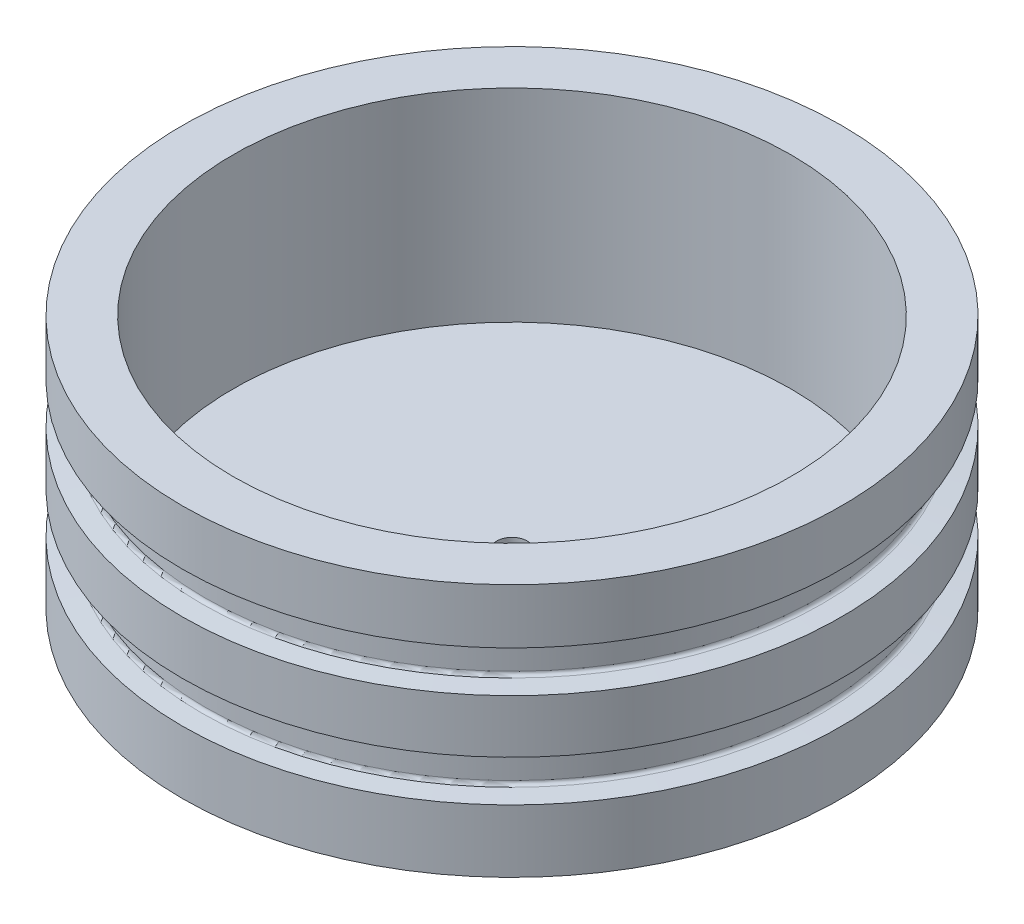
from build123d import *

# Parameters (mm, degrees)
LPATTERN1_COUNT = 2
LPATTERN1_PITCH = 11.853333333


with BuildPart() as part:
    # Sketch1 → Revolve1 (revolve)
    with BuildSketch(Plane.XY):
        Polygon((-41.275, 0), (-41.275, 31.75), (-34.925, 31.75), (-34.925, 6.35), (-1.91325754, 6.35), (-1.91325754, 0), (-1.91325754, -12.7), (-6.35, -12.7), (-6.35, 0), align=None)
    revolve(axis=Axis((0, 0, 0), (0, 1, 0)))

    # Sketch13 → Groove for AS 568-234, O-Ring1 (revolve, cut)
    with BuildSketch(Plane(origin=(0, 0, 0), x_dir=(0, 0, -1), z_dir=(-1, 0, 0))):
        with BuildLine():
            Line((38.861359272, -19.923256056), (41.3639, -19.704312113))
            Line((41.3639, -19.704312113), (41.3639, -24.892))
            Line((41.3639, -24.892), (38.861359272, -24.673056056))
            ThreePointArc((38.861359272, -24.673056056), (38.572380224, -24.53054736), (38.4556, -24.230247513))
            Line((38.4556, -24.230247513), (38.4556, -20.3660646))
            ThreePointArc((38.4556, -20.3660646), (38.572380224, -20.065764752), (38.861359272, -19.923256056))
        make_face()
    groove_for_as_568_234_o_ring1 = revolve(axis=Axis((0, -50, 0), (0, 1, 0)), mode=Mode.SUBTRACT)

    # LPattern1: Groove for AS 568-234, O-Ring1 ×2
    with Locations(*[(0, -i * LPATTERN1_PITCH, 0) for i in range(1, LPATTERN1_COUNT)]):
        add(groove_for_as_568_234_o_ring1, mode=Mode.SUBTRACT)


solid = part.part
